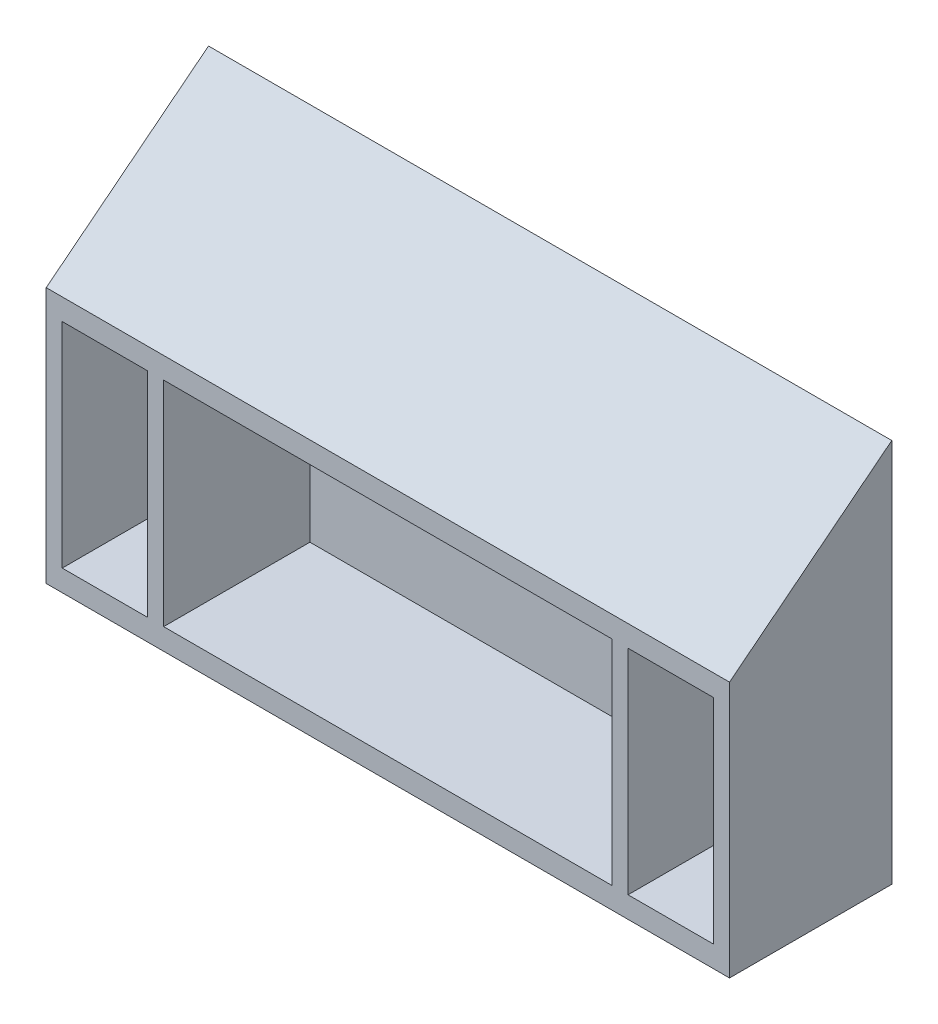
from build123d import *

# Parameters (mm, degrees)
SKETCH1_W           = 203.2
SKETCH1_H           = 76.2
SKETCH1_W_2         = 25.4
SKETCH1_H_2         = 63.5
BOSS_EXTRUDE1_DEPTH = 48.26
SKETCH2_W           = 133.35
SKETCH2_H           = 63.5
CUT_EXTRUDE1_DEPTH  = 43.4975
BOSS_EXTRUDE3_DEPTH = 203.2


with BuildPart() as part:
    # Sketch1 → Boss-Extrude1 (new body)
    with BuildSketch(Plane.XY):
        Rectangle(SKETCH1_W, SKETCH1_H)
        with Locations((-84.1375, 0)):
            Rectangle(SKETCH1_W_2, SKETCH1_H_2, mode=Mode.SUBTRACT)
        with Locations((84.1375, 0)):
            Rectangle(SKETCH1_W_2, SKETCH1_H_2, mode=Mode.SUBTRACT)
    extrude(amount=BOSS_EXTRUDE1_DEPTH)

    # Sketch2 → Cut-Extrude1 (cut)
    with BuildSketch(Plane.XY.offset(48.26)):
        Rectangle(SKETCH2_W, SKETCH2_H)
    extrude(amount=-CUT_EXTRUDE1_DEPTH, mode=Mode.SUBTRACT)

    # Sketch3 → Boss-Extrude3 (add)
    with BuildSketch(Plane(origin=(101.6, 0, 0), x_dir=(0, 0, -1), z_dir=(1, 0, 0))):
        Polygon((-48.26, 38.1), (0, 76.2), (0, 38.1), align=None)
    extrude(amount=-BOSS_EXTRUDE3_DEPTH)


solid = part.part
